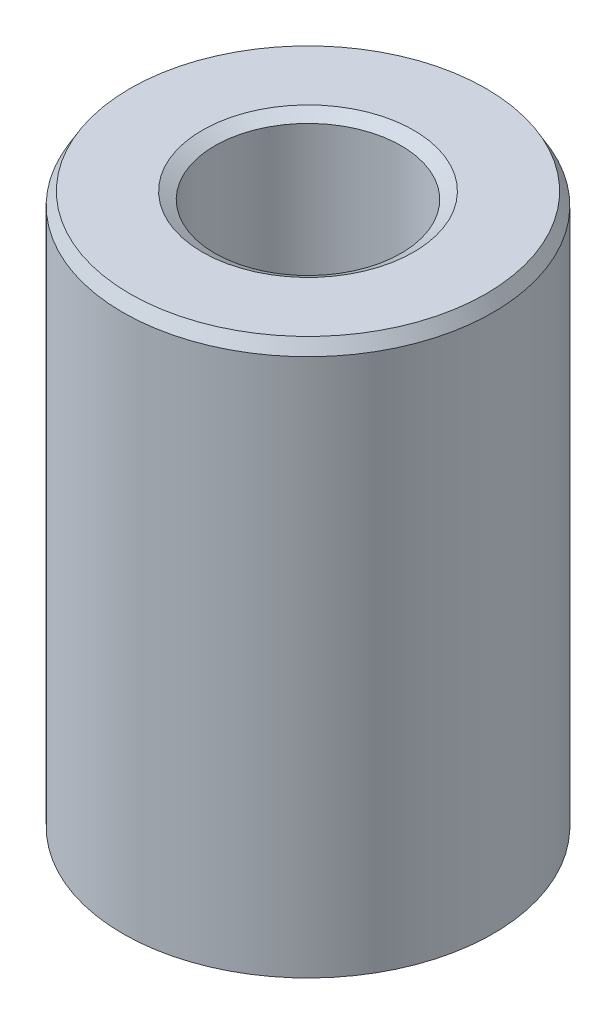
from build123d import *
from OCP.BRepFilletAPI import BRepFilletAPI_MakeChamfer

# Parameters (mm, degrees)
SKETCH1_R           = 55
BOSS_EXTRUDE1_DEPTH = 165.681292714
SKETCH2_R           = 27.685647832
CUT_EXTRUDE1_DEPTH  = 184.030846459
CHAMFER1_SIZE       = 3.705281478
CHAMFER1_SIZE2      = 2.139245258


with BuildPart() as part:
    # Sketch1 → Boss-Extrude1 (new body)
    with BuildSketch(Plane(origin=(0, 0, 0), x_dir=(1, 0, 0), z_dir=(0, 1, 0))):
        Circle(SKETCH1_R)
    extrude(amount=BOSS_EXTRUDE1_DEPTH)

    # Sketch2 → Cut-Extrude1 (cut, through all)
    with BuildSketch(Plane(origin=(0, 0, 0), x_dir=(1, 0, 0), z_dir=(0, 1, 0))):
        Circle(SKETCH2_R)
    extrude(amount=CUT_EXTRUDE1_DEPTH, mode=Mode.SUBTRACT)

    # Chamfer1: one chamfer whose edges measure the first distance from different faces: ONE call of the kernel's chamfer builder (chamfer() names one face for all edges)
    chamfer1_edges_1 = [part.edges().sort_by_distance(p)[0] for p in [
        (-27.685647832, 165.681292714, 0),
    ]]
    chamfer1_side_1 = [part.faces().sort_by_distance(p)[0] for p in [
        (-53.444365081, 165.681292714, 0),
    ]]
    chamfer1_edges_2 = [part.edges().sort_by_distance(p)[0] for p in [
        (-27.685647832, 0, 0),
    ]]
    chamfer1_side_2 = [part.faces().sort_by_distance(p)[0] for p in [
        (-27.685647832, 82.840646357, 0),
    ]]
    chamfer1_edges_3 = [part.edges().sort_by_distance(p)[0] for p in [
        (-55, 0, 0),
    ]]
    chamfer1_side_3 = [part.faces().sort_by_distance(p)[0] for p in [
        (-53.444365081, 0, 0),
    ]]
    chamfer1_edges_4 = [part.edges().sort_by_distance(p)[0] for p in [
        (-55, 165.681292714, 0),
    ]]
    chamfer1_side_4 = [part.faces().sort_by_distance(p)[0] for p in [
        (-55, 82.840646357, 0),
    ]]
    chamfer1 = BRepFilletAPI_MakeChamfer(part.part.solid().wrapped)
    for e in chamfer1_edges_1:
        chamfer1.Add(CHAMFER1_SIZE, CHAMFER1_SIZE2, e.wrapped, chamfer1_side_1[0].wrapped)  # the first distance lies on this face
    for e in chamfer1_edges_2:
        chamfer1.Add(CHAMFER1_SIZE, CHAMFER1_SIZE2, e.wrapped, chamfer1_side_2[0].wrapped)  # the first distance lies on this face
    for e in chamfer1_edges_3:
        chamfer1.Add(CHAMFER1_SIZE, CHAMFER1_SIZE2, e.wrapped, chamfer1_side_3[0].wrapped)  # the first distance lies on this face
    for e in chamfer1_edges_4:
        chamfer1.Add(CHAMFER1_SIZE, CHAMFER1_SIZE2, e.wrapped, chamfer1_side_4[0].wrapped)  # the first distance lies on this face
    add(Compound.cast(chamfer1.Shape()), mode=Mode.REPLACE)


solid = part.part
